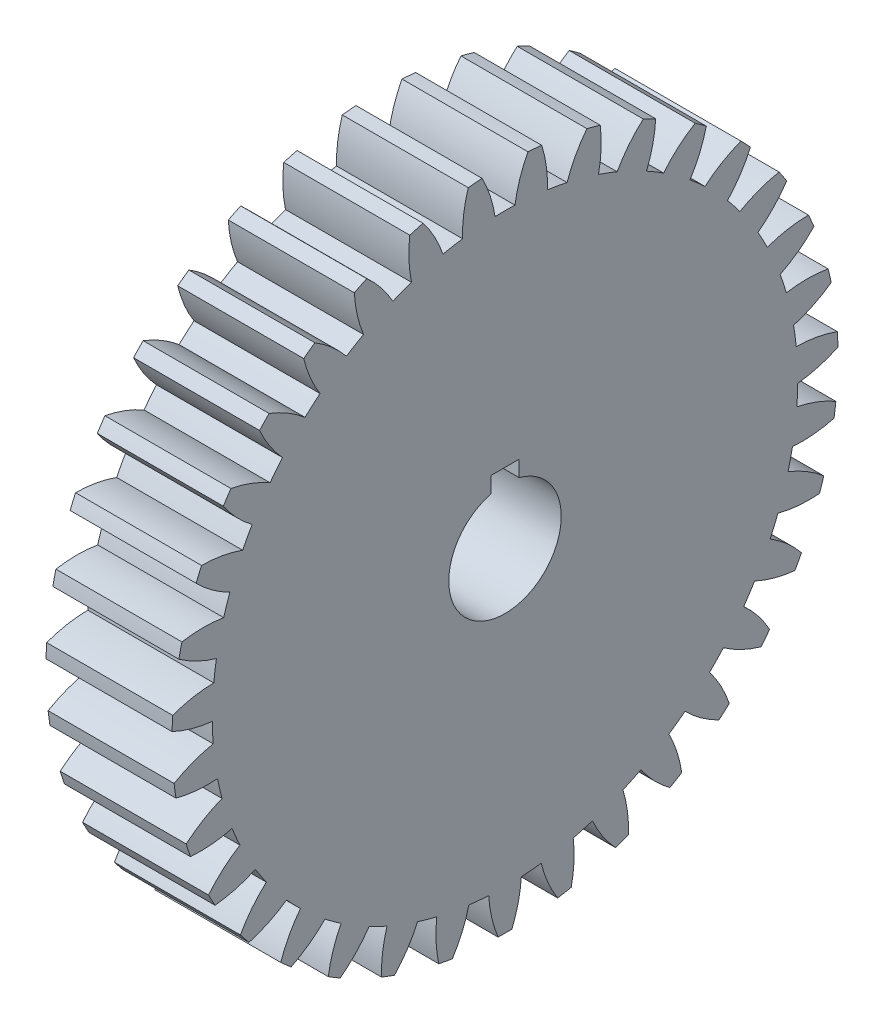
from build123d import *

# Parameters (mm, degrees)
SPUR_START             = -41.92553798
SPUR_GEAR_AI_OUTLINE_R = 3.96875
SPUR_GEAR_AI_DEPTH     = 8.89
SKETCH1_W              = 2
SKETCH1_H              = 2
CUT_EXTRUDE1_DEPTH     = 52.703258087


# Read off the part's stored shape, not the designer's step: spur gear_ai
with BuildPart() as part:
    # spur gear_ai outline → spur gear_ai (new body)
    with BuildSketch(Plane.YZ.offset(SPUR_START)):
        with BuildLine():
            ThreePointArc((29.197583743, 10.864355229), (29.331942171, 11.332236482), (29.456578297, 11.80280092))
            ThreePointArc((29.456578297, 11.80280092), (28.219125437, 12.612367049), (26.864596619, 13.205611165))
            ThreePointArc((26.864596619, 13.205611165), (27.00197755, 13.895536579), (27.115779153, 14.589741011))
            ThreePointArc((27.115779153, 14.589741011), (28.592387312, 14.669209514), (30.035394987, 14.992343774))
            ThreePointArc((30.035394987, 14.992343774), (30.084050797, 15.476696606), (30.122661443, 15.961953519))
            ThreePointArc((30.122661443, 15.961953519), (28.760541345, 16.537553847), (27.321852536, 16.879403826))
            ThreePointArc((27.321852536, 16.879403826), (27.333834759, 17.582772168), (27.321852536, 18.28614051))
            ThreePointArc((27.321852536, 18.28614051), (28.760541345, 18.62799049), (30.122661443, 19.203590818))
            ThreePointArc((30.122661443, 19.203590818), (30.084050797, 19.688847731), (30.035394987, 20.173200563))
            ThreePointArc((30.035394987, 20.173200563), (28.592387312, 20.496334823), (27.115779153, 20.575803325))
            ThreePointArc((27.115779153, 20.575803325), (27.00197755, 21.270007757), (26.864596619, 21.959933172))
            ThreePointArc((26.864596619, 21.959933172), (28.219125437, 22.553177288), (29.456578297, 23.362743417))
            ThreePointArc((29.456578297, 23.362743417), (29.331942171, 23.833307855), (29.197583743, 24.301189108))
            ThreePointArc((29.197583743, 24.301189108), (27.720067945, 24.361471497), (26.252999837, 24.17600434))
            ThreePointArc((26.252999837, 24.17600434), (26.017072085, 24.838732561), (25.758707983, 25.493040278))
            ThreePointArc((25.758707983, 25.493040278), (26.985541138, 26.318611176), (28.058554007, 27.336122985))
            ThreePointArc((28.058554007, 27.336122985), (27.851898311, 27.776870619), (27.636155654, 28.213242204))
            ThreePointArc((27.636155654, 28.213242204), (26.171620307, 28.008735197), (24.761245026, 27.564293449))
            ThreePointArc((24.761245026, 27.564293449), (24.410774037, 28.174244827), (24.039730798, 28.771904858))
            ThreePointArc((24.039730798, 28.771904858), (25.099436863, 29.803268011), (25.973522225, 30.996021832))
            ThreePointArc((25.973522225, 30.996021832), (25.691489042, 31.392786671), (25.401296303, 31.783623246))
            ThreePointArc((25.401296303, 31.783623246), (23.996812778, 31.320899867), (22.688460947, 30.63176825))
            ThreePointArc((22.688460947, 30.63176825), (22.234711146, 31.169338447), (21.762914405, 31.691141507))
            ThreePointArc((21.762914405, 31.691141507), (22.621433557, 32.895148054), (23.268497589, 34.224807799))
            ThreePointArc((23.268497589, 34.224807799), (22.920151697, 34.564837494), (22.56483591, 34.89757725))
            ThreePointArc((22.56483591, 34.89757725), (21.265545462, 34.191509809), (20.101268585, 33.27983758))
            ThreePointArc((20.101268585, 33.27983758), (19.558823866, 33.727748648), (19.001437558, 34.156923557))
            ThreePointArc((19.001437558, 34.156923557), (19.631176283, 35.494875737), (20.030421815, 36.918705047))
            ThreePointArc((20.030421815, 36.918705047), (19.626959338, 37.191070765), (19.217940644, 37.455019172))
            ThreePointArc((19.217940644, 37.455019172), (18.065603538, 36.528301258), (17.082822432, 35.423390313))
            ThreePointArc((17.082822432, 35.423390313), (16.469117413, 35.76724602), (15.844056394, 36.089998744))
            ThreePointArc((15.844056394, 36.089998744), (16.224774371, 37.518893674), (16.363369323, 38.991129503))
            ThreePointArc((16.363369323, 38.991129503), (15.917757878, 39.187077185), (15.468182475, 39.373750725))
            ThreePointArc((15.468182475, 39.373750725), (14.499835773, 38.256167813), (13.730137831, 36.993530899))
            ThreePointArc((13.730137831, 36.993530899), (13.064897496, 37.222279441), (12.392251741, 37.428236441))
            ThreePointArc((12.392251741, 37.428236441), (12.511712382, 38.902148261), (12.385202198, 40.37547174))
            ThreePointArc((12.385202198, 40.37547174), (11.911764102, 40.488703465), (11.436081713, 40.592102297))
            ThreePointArc((11.436081713, 40.592102297), (10.682848876, 39.319574422), (10.150972823, 37.939793728))
            ThreePointArc((10.150972823, 37.939793728), (9.455578545, 38.046082939), (8.756967441, 38.128624588))
            ThreePointArc((8.756967441, 38.128624588), (8.611331183, 39.60018056), (8.223782004, 41.027237858))
            ThreePointArc((8.223782004, 41.027237858), (7.737733948, 41.054114267), (7.251233396, 41.070915066))
            ThreePointArc((7.251233396, 41.070915066), (6.737323946, 39.684342322), (6.460364717, 38.231765135))
            ThreePointArc((6.460364717, 38.231765135), (5.75716704, 38.212178791), (5.055044523, 38.168652132))
            ThreePointArc((5.055044523, 38.168652132), (4.648992235, 39.590555237), (4.01286021, 40.925479559))
            ThreePointArc((4.01286021, 40.925479559), (3.529824178, 40.865136821), (3.048141992, 40.794799597))
            ThreePointArc((3.048141992, 40.794799597), (2.790073402, 39.338747571), (2.776932693, 37.860060917))
            ThreePointArc((2.776932693, 37.860060917), (2.088532968, 37.715228541), (1.405465835, 37.547032557))
            ThreePointArc((1.405465835, 37.547032557), (0.752048371, 38.873581658), (-0.112220692, 40.073467438))
            ThreePointArc((-0.112220692, 40.073467438), (-0.576719524, 39.927845019), (-1.038101683, 39.772630467))
            ThreePointArc((-1.038101683, 39.772630467), (-1.032034876, 38.29389787), (-0.780934711, 36.836627955))
            ThreePointArc((-0.780934711, 36.836627955), (-1.432410749, 36.571204577), (-2.074468161, 36.283745226))
            ThreePointArc((-2.074468161, 36.283745226), (-2.954249425, 37.472303943), (-4.018877208, 38.498585865))
            ThreePointArc((-4.018877208, 38.498585865), (-4.449909465, 38.272364189), (-4.876162395, 38.037261034))
            ThreePointArc((-4.876162395, 38.037261034), (-4.606155184, 36.583375549), (-4.098884711, 35.194360226))
            ThreePointArc((-4.098884711, 35.194360226), (-4.692498087, 34.816876772), (-5.272909523, 34.419393233))
            ThreePointArc((-5.272909523, 34.419393233), (-6.350777694, 35.431760312), (-7.581546183, 36.251452831))
            ThreePointArc((-7.581546183, 36.251452831), (-7.965258135, 35.951902849), (-8.342681716, 35.644467498))
            ThreePointArc((-8.342681716, 35.644467498), (-7.817412354, 34.2621582), (-7.070275663, 32.986041566))
            ThreePointArc((-7.070275663, 32.986041566), (-7.586947155, 32.508630665), (-8.087057713, 32.013898387))
            ThreePointArc((-8.087057713, 32.013898387), (-9.328369222, 32.817535517), (-10.685720506, 33.404293039))
            ThreePointArc((-10.685720506, 33.404293039), (-11.009779335, 33.041042534), (-11.326242861, 32.671156214))
            ThreePointArc((-11.326242861, 32.671156214), (-10.562593938, 31.404851661), (-9.599604618, 30.282649153))
            ThreePointArc((-9.599604618, 30.282649153), (-10.022727978, 29.720655185), (-10.426463694, 29.144575269))
            ThreePointArc((-10.426463694, 29.144575269), (-11.791321767, 29.713652892), (-13.231629459, 30.048616549))
            ThreePointArc((-13.231629459, 30.048616549), (-13.485619646, 29.633340691), (-13.730951721, 29.212891851))
            ThreePointArc((-13.730951721, 29.212891851), (-12.753467541, 28.103292114), (-11.605576861, 27.171072245))
            ThreePointArc((-11.605576861, 27.171072245), (-11.921552557, 26.542558158), (-12.215937033, 25.903646287))
            ThreePointArc((-12.215937033, 25.903646287), (-13.660474008, 26.219873779), (-15.137445433, 26.292277564))
            ThreePointArc((-15.137445433, 26.292277564), (-15.313203526, 25.83832366), (-15.479518975, 25.380825873))
            ThreePointArc((-15.479518975, 25.380825873), (-14.319616685, 24.463594399), (-13.023718794, 23.751319483))
            ThreePointArc((-13.023718794, 23.751319483), (-13.222391107, 23.076486237), (-13.397962584, 22.395277565))
            ThreePointArc((-13.397962584, 22.395277565), (-14.875749854, 22.448491114), (-16.341913936, 22.256007909))
            ThreePointArc((-16.341913936, 22.256007909), (-16.433790925, 21.777966412), (-16.515744231, 21.298124032))
            ThreePointArc((-16.515744231, 21.298124032), (-15.210704044, 20.602741397), (-13.808450169, 20.133304535))
            ThreePointArc((-13.808450169, 20.133304535), (-13.883433607, 19.433841825), (-13.934549073, 18.732230959))
            ThreePointArc((-13.934549073, 18.732230959), (-15.39808934, 18.520720238), (-16.806322358, 18.069536612))
            ThreePointArc((-16.806322358, 18.069536612), (-16.811365241, 17.582772169), (-16.806322358, 17.096007725))
            ThreePointArc((-16.806322358, 17.096007725), (-15.39808934, 16.644824099), (-13.934549073, 16.433313378))
            ThreePointArc((-13.934549073, 16.433313378), (-13.883433607, 15.731702512), (-13.808450169, 15.032239802))
            ThreePointArc((-13.808450169, 15.032239802), (-15.210704044, 14.56280294), (-16.515744231, 13.867420305))
            ThreePointArc((-16.515744231, 13.867420305), (-16.433790925, 13.387577925), (-16.341913936, 12.909536428))
            ThreePointArc((-16.341913936, 12.909536428), (-14.875749854, 12.717053223), (-13.397962584, 12.770266772))
            ThreePointArc((-13.397962584, 12.770266772), (-13.222391107, 12.0890581), (-13.023718794, 11.414224854))
            ThreePointArc((-13.023718794, 11.414224854), (-14.319616684, 10.701949937), (-15.479518975, 9.784718464))
            ThreePointArc((-15.479518975, 9.784718464), (-15.313203526, 9.327220677), (-15.137445433, 8.873266773))
            ThreePointArc((-15.137445433, 8.873266773), (-13.660474008, 8.945670558), (-12.215937033, 9.261898049))
            ThreePointArc((-12.215937033, 9.261898049), (-11.921552557, 8.622986179), (-11.605576861, 7.994472092))
            ThreePointArc((-11.605576861, 7.994472092), (-12.753467541, 7.062252223), (-13.730951721, 5.952652486))
            ThreePointArc((-13.730951721, 5.952652486), (-13.485619646, 5.532203646), (-13.231629459, 5.116927788))
            ThreePointArc((-13.231629459, 5.116927788), (-11.791321767, 5.451891445), (-10.426463694, 6.020969067))
            ThreePointArc((-10.426463694, 6.020969067), (-10.022727978, 5.444889151), (-9.599604618, 4.882895183))
            ThreePointArc((-9.599604618, 4.882895183), (-10.562593938, 3.760692676), (-11.326242861, 2.494388123))
            ThreePointArc((-11.326242861, 2.494388123), (-11.009779335, 2.124501802), (-10.685720506, 1.761251297))
            ThreePointArc((-10.685720506, 1.761251297), (-9.328369222, 2.34800882), (-8.087057713, 3.15164595))
            ThreePointArc((-8.087057713, 3.15164595), (-7.586947155, 2.656913671), (-7.070275663, 2.179502771))
            ThreePointArc((-7.070275663, 2.179502771), (-7.817412354, 0.903386137), (-8.342681716, -0.478923162))
            ThreePointArc((-8.342681716, -0.478923162), (-7.965258135, -0.786358512), (-7.581546183, -1.085908494))
            ThreePointArc((-7.581546183, -1.085908494), (-6.350777694, -0.266215976), (-5.272909523, 0.746151104))
            ThreePointArc((-5.272909523, 0.746151104), (-4.692498088, 0.348667564), (-4.098884711, -0.028815889))
            ThreePointArc((-4.098884711, -0.028815889), (-4.606155184, -1.417831212), (-4.876162395, -2.871716697))
            ThreePointArc((-4.876162395, -2.871716697), (-4.449909466, -3.106819853), (-4.018877208, -3.333041528))
            ThreePointArc((-4.018877208, -3.333041528), (-2.954249425, -2.306759606), (-2.074468161, -1.118200889))
            ThreePointArc((-2.074468161, -1.118200889), (-1.432410749, -1.40566024), (-0.780934711, -1.671083618))
            ThreePointArc((-0.780934711, -1.671083618), (-1.032034876, -3.128353533), (-1.038101683, -4.60708613))
            ThreePointArc((-1.038101683, -4.60708613), (-0.576719524, -4.762300682), (-0.112220692, -4.907923101))
            ThreePointArc((-0.112220692, -4.907923101), (0.752048371, -3.708037321), (1.405465835, -2.38148822))
            ThreePointArc((1.405465835, -2.38148822), (2.088532969, -2.549684204), (2.776932693, -2.694516581))
            ThreePointArc((2.776932693, -2.694516581), (2.790073402, -4.173203235), (3.048141992, -5.62925526))
            ThreePointArc((3.048141992, -5.62925526), (3.529824178, -5.699592484), (4.01286021, -5.759935222))
            ThreePointArc((4.01286021, -5.759935222), (4.648992235, -4.4250109), (5.055044523, -3.003107795))
            ThreePointArc((5.055044523, -3.003107795), (5.75716704, -3.046634454), (6.460364717, -3.066220798))
            ThreePointArc((6.460364717, -3.066220798), (6.737323946, -4.518797985), (7.251233396, -5.905370729))
            ThreePointArc((7.251233396, -5.905370729), (7.737733948, -5.88856993), (8.223782004, -5.861693521))
            ThreePointArc((8.223782004, -5.861693521), (8.611331183, -4.434636223), (8.756967441, -2.963080251))
            ThreePointArc((8.756967441, -2.963080251), (9.455578545, -2.880538602), (10.150972823, -2.774249392))
            ThreePointArc((10.150972823, -2.774249392), (10.682848876, -4.154030085), (11.436081713, -5.42655796))
            ThreePointArc((11.436081713, -5.42655796), (11.911764102, -5.323159128), (12.385202198, -5.209927403))
            ThreePointArc((12.385202198, -5.209927403), (12.511712382, -3.736603924), (12.392251741, -2.262692104))
            ThreePointArc((12.392251741, -2.262692104), (13.064897496, -2.056735104), (13.730137831, -1.827986562))
            ThreePointArc((13.730137831, -1.827986562), (14.499835773, -3.090623476), (15.468182475, -4.208206388))
            ThreePointArc((15.468182475, -4.208206388), (15.917757878, -4.021532848), (16.363369323, -3.825585166))
            ThreePointArc((16.363369323, -3.825585166), (16.224774371, -2.353349337), (15.844056394, -0.924454407))
            ThreePointArc((15.844056394, -0.924454407), (16.469117413, -0.601701684), (17.082822432, -0.257845976))
            ThreePointArc((17.082822432, -0.257845976), (18.065603538, -1.362756921), (19.217940644, -2.289474835))
            ThreePointArc((19.217940644, -2.289474835), (19.626959338, -2.025526428), (20.030421815, -1.75316071))
            ThreePointArc((20.030421815, -1.75316071), (19.631176283, -0.3293314), (19.001437558, 1.00862078))
            ThreePointArc((19.001437558, 1.00862078), (19.558823866, 1.437795689), (20.101268585, 1.885706756))
            ThreePointArc((20.101268585, 1.885706756), (21.265545462, 0.974034527), (22.56483591, 0.267967087))
            ThreePointArc((22.56483591, 0.267967087), (22.920151697, 0.600706843), (23.268497589, 0.940736538))
            ThreePointArc((23.268497589, 0.940736538), (22.621433557, 2.270396283), (21.762914405, 3.47440283))
            ThreePointArc((21.762914405, 3.47440283), (22.234711146, 3.99620589), (22.688460947, 4.533776087))
            ThreePointArc((22.688460947, 4.533776087), (23.996812778, 3.84464447), (25.401296303, 3.381921091))
            ThreePointArc((25.401296303, 3.381921091), (25.691489042, 3.772757666), (25.973522225, 4.169522505))
            ThreePointArc((25.973522225, 4.169522505), (25.099436863, 5.362276326), (24.039730798, 6.393639479))
            ThreePointArc((24.039730798, 6.393639479), (24.410774037, 6.99129951), (24.761245026, 7.601250888))
            ThreePointArc((24.761245026, 7.601250888), (26.171620307, 7.15680914), (27.636155654, 6.952302133))
            ThreePointArc((27.636155654, 6.952302133), (27.851898311, 7.388673718), (28.058554007, 7.829421352))
            ThreePointArc((28.058554007, 7.829421352), (26.985541138, 8.846933161), (25.758707983, 9.672504059))
            ThreePointArc((25.758707983, 9.672504059), (26.017072085, 10.326811776), (26.252999837, 10.989539996))
            ThreePointArc((26.252999837, 10.989539996), (27.720067945, 10.80407284), (29.197583743, 10.864355229))
        make_face()
        with Locations((6.683634759, 17.582772168)):
            Circle(SPUR_GEAR_AI_OUTLINE_R, mode=Mode.SUBTRACT)
    extrude(amount=SPUR_GEAR_AI_DEPTH)

    # Sketch1 → Cut-Extrude1 (cut, through all)
    with BuildSketch(Plane(origin=(-33.03553798, 0, 0), x_dir=(0, 0, -1), z_dir=(1, 0, 0))):
        with Locations((-17.582772168, 10.652384759)):
            Rectangle(SKETCH1_W, SKETCH1_H)
    extrude(amount=-CUT_EXTRUDE1_DEPTH, mode=Mode.SUBTRACT)


solid = part.part
